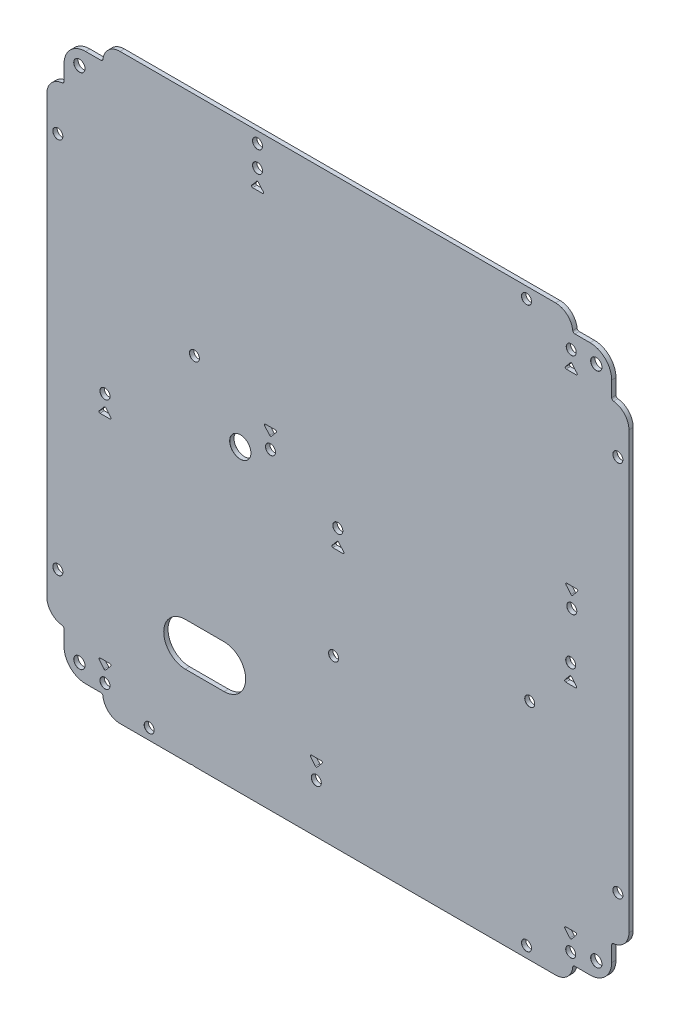
from build123d import *

# Parameters (mm, degrees)
SKETCH1_W                                = 270
SKETCH1_H                                = 270
BOSS_EXTRUDE1_DEPTH                      = 1
F_5_2_5_2_DIAMETER_HOLE1_AT_2_COUNT      = 2
F_5_2_5_2_DIAMETER_HOLE1_AT_2_PITCH      = 239.75
F_5_2_5_2_DIAMETER_HOLE1_AT_3_COUNT      = 2
F_5_2_5_2_DIAMETER_HOLE1_AT_3_PITCH      = 339.057701579
F_5_2_5_2_DIAMETER_HOLE1_AT_4_COUNT      = 2
F_5_2_5_2_DIAMETER_HOLE1_AT_4_PITCH      = 239.75
CUT_EXTRUDE1_DEPTH                       = 191.921449816
MIRROR1_AT_THE_SECOND_PLANE_COPY_1_DEPTH = 191.921449816
F_4_6_4_6_DIAMETER_HOLE1_AT_2_COUNT      = 2
F_4_6_4_6_DIAMETER_HOLE1_AT_2_PITCH      = 175
F_4_6_4_6_DIAMETER_HOLE1_AT_3_COUNT      = 2
F_4_6_4_6_DIAMETER_HOLE1_AT_3_PITCH      = 313.201313056
F_4_6_4_6_DIAMETER_HOLE1_AT_4_COUNT      = 2
F_4_6_4_6_DIAMETER_HOLE1_AT_4_PITCH      = 259.75
F_4_6_4_6_DIAMETER_HOLE1_AT_5_COUNT      = 2
F_4_6_4_6_DIAMETER_HOLE1_AT_5_PITCH      = 307.414673121
F_4_6_4_6_DIAMETER_HOLE1_AT_6_COUNT      = 2
F_4_6_4_6_DIAMETER_HOLE1_AT_6_PITCH      = 221.466772338
F_4_6_4_6_DIAMETER_HOLE1_AT_7_COUNT      = 2
F_4_6_4_6_DIAMETER_HOLE1_AT_7_PITCH      = 59.927299706
F_4_6_4_6_DIAMETER_HOLE1_AT_8_COUNT      = 2
F_4_6_4_6_DIAMETER_HOLE1_AT_8_PITCH      = 172.413474676
CUT_EXTRUDE2_DEPTH                       = 191.921449816
CUT_EXTRUDE2_DEPTH_BACK                  = 191.921449816
F_4_6_4_6_DIAMETER_HOLE2_AT_2_COUNT      = 2
F_4_6_4_6_DIAMETER_HOLE2_AT_2_PITCH      = 145.5
F_4_6_4_6_DIAMETER_HOLE2_AT_3_COUNT      = 2
F_4_6_4_6_DIAMETER_HOLE2_AT_3_PITCH      = 110.163514831
F_4_6_4_6_DIAMETER_HOLE2_AT_4_COUNT      = 2
F_4_6_4_6_DIAMETER_HOLE2_AT_4_PITCH      = 179.050446802
F_4_6_4_6_DIAMETER_HOLE2_AT_5_COUNT      = 2
F_4_6_4_6_DIAMETER_HOLE2_AT_5_PITCH      = 258.951625815
F_4_6_4_6_DIAMETER_HOLE3_AT_2_COUNT      = 2
F_4_6_4_6_DIAMETER_HOLE3_AT_2_PITCH      = 108
F_4_6_4_6_DIAMETER_HOLE3_AT_3_COUNT      = 2
F_4_6_4_6_DIAMETER_HOLE3_AT_3_PITCH      = 216
F_4_6_4_6_DIAMETER_HOLE3_AT_4_COUNT      = 2
F_4_6_4_6_DIAMETER_HOLE3_AT_4_PITCH      = 116.25
F_4_6_4_6_DIAMETER_HOLE3_AT_5_COUNT      = 2
F_4_6_4_6_DIAMETER_HOLE3_AT_5_PITCH      = 144.544327111
F_4_6_4_6_DIAMETER_HOLE3_AT_6_COUNT      = 2
F_4_6_4_6_DIAMETER_HOLE3_AT_6_PITCH      = 245.295867271
CUT_EXTRUDE3_DEPTH                       = 191.921449816
CUT_EXTRUDE4_DEPTH                       = 191.921449816
F_4_6_4_6_DIAMETER_HOLE4_AT_2_COUNT      = 2
F_4_6_4_6_DIAMETER_HOLE4_AT_2_PITCH      = 109.308336828
F_4_6_4_6_DIAMETER_HOLE4_AT_3_COUNT      = 2
F_4_6_4_6_DIAMETER_HOLE4_AT_3_PITCH      = 167.03667262


with BuildPart() as part:
    # Sketch1 → Boss-Extrude1 (new, symmetric)
    with BuildSketch(Plane.XY):
        Rectangle(SKETCH1_W, SKETCH1_H)
    extrude(amount=BOSS_EXTRUDE1_DEPTH, both=True)

    # Sketch11 → Ø5.2 (5.2) Diameter Hole1 (revolve, cut)
    with BuildSketch(Plane(origin=(119.875, 119.875, 1), x_dir=(0, -1, 0), z_dir=(1, 0, 0))):
        Polygon((0, 0), (0, 2), (2.625, 2), (2.6, 1.975), (2.6, 0.025), (2.625, 0), align=None)
    f_5_2_5_2_diameter_hole1 = revolve(axis=Axis((119.875, 119.875, 7.35), (0, 0, -1)), mode=Mode.SUBTRACT)

    # Ø5.2 (5.2) Diameter Hole1 at 2: Ø5.2 (5.2) Diameter Hole1 ×2
    with Locations(*[(0, -i * F_5_2_5_2_DIAMETER_HOLE1_AT_2_PITCH, 0) for i in range(1, F_5_2_5_2_DIAMETER_HOLE1_AT_2_COUNT)]):
        add(f_5_2_5_2_diameter_hole1, mode=Mode.SUBTRACT)

    # Ø5.2 (5.2) Diameter Hole1 at 3: Ø5.2 (5.2) Diameter Hole1 ×2
    with Locations(*[Vector(-0.7071067811865476, -0.7071067811865476, 0) * (i * F_5_2_5_2_DIAMETER_HOLE1_AT_3_PITCH) for i in range(1, F_5_2_5_2_DIAMETER_HOLE1_AT_3_COUNT)]):
        add(f_5_2_5_2_diameter_hole1, mode=Mode.SUBTRACT)

    # Ø5.2 (5.2) Diameter Hole1 at 4: Ø5.2 (5.2) Diameter Hole1 ×2
    with Locations(*[(-i * F_5_2_5_2_DIAMETER_HOLE1_AT_4_PITCH, 0, 0) for i in range(1, F_5_2_5_2_DIAMETER_HOLE1_AT_4_COUNT)]):
        add(f_5_2_5_2_diameter_hole1, mode=Mode.SUBTRACT)

    # Sketch12 → Cut-Extrude1 (cut, symmetric)
    with BuildSketch(Plane.XY):
        with BuildLine():
            Line((-127, 109.94427191), (-127, 117))
            ThreePointArc((-127, 117), (-124.071067812, 124.071067812), (-117, 127))
            Line((-117, 127), (-109.94427191, 127))
            ThreePointArc((-109.94427191, 127), (-109.277605243, 127.254644008), (-108.95046392, 127.888888889))
            ThreePointArc((-108.95046392, 127.888888889), (-106.333333333, 132.96284794), (-101, 135))
            Line((-101, 135), (-135, 135))
            Line((-135, 135), (-135, 101))
            ThreePointArc((-135, 101), (-132.96284794, 106.333333333), (-127.888888889, 108.95046392))
            ThreePointArc((-127.888888889, 108.95046392), (-127.254644008, 109.277605243), (-127, 109.94427191))
        make_face()
    cut_extrude1 = extrude(amount=CUT_EXTRUDE1_DEPTH, both=True, mode=Mode.SUBTRACT)

    # Mirror1: Cut-Extrude1 across plane
    add(cut_extrude1.mirror(Plane(origin=(0, 0, 0), x_dir=(0, 0, 1), z_dir=(1, 0, 0))), mode=Mode.SUBTRACT)

    # Mirror1 at the second plane: Cut-Extrude1 across plane
    add(cut_extrude1.mirror(Plane.ZX), mode=Mode.SUBTRACT)

    # Mirror1 at the second plane copy 1 sketc → Mirror1 at the second plane copy 1 (cut, symmetric)
    with BuildSketch(Plane(origin=(0, 0, 0), x_dir=(-1, 0, 0), z_dir=(0, 0, 1))):
        with BuildLine():
            Line((-127, 109.94427191), (-127, 117))
            ThreePointArc((-127, 117), (-124.071067812, 124.071067812), (-117, 127))
            Line((-117, 127), (-109.94427191, 127))
            ThreePointArc((-109.94427191, 127), (-109.277605243, 127.254644008), (-108.95046392, 127.888888889))
            ThreePointArc((-108.95046392, 127.888888889), (-106.333333333, 132.96284794), (-101, 135))
            Line((-101, 135), (-135, 135))
            Line((-135, 135), (-135, 101))
            ThreePointArc((-135, 101), (-132.96284794, 106.333333333), (-127.888888889, 108.95046392))
            ThreePointArc((-127.888888889, 108.95046392), (-127.254644008, 109.277605243), (-127, 109.94427191))
        make_face()
    extrude(amount=MIRROR1_AT_THE_SECOND_PLANE_COPY_1_DEPTH, both=True, mode=Mode.SUBTRACT)

    # Sketch15 → Ø4.6 (4.6) Diameter Hole1 (revolve, cut)
    with BuildSketch(Plane(origin=(129.875, 87.5, 1), x_dir=(0, -1, 0), z_dir=(1, 0, 0))):
        Polygon((0, 0), (0, 2), (2.325, 2), (2.3, 1.975), (2.3, 0.025), (2.325, 0), align=None)
    f_4_6_4_6_diameter_hole1 = revolve(axis=Axis((129.875, 87.5, 7.35), (0, 0, -1)), mode=Mode.SUBTRACT)

    # Ø4.6 (4.6) Diameter Hole1 at 2: Ø4.6 (4.6) Diameter Hole1 ×2
    with Locations(*[(0, -i * F_4_6_4_6_DIAMETER_HOLE1_AT_2_PITCH, 0) for i in range(1, F_4_6_4_6_DIAMETER_HOLE1_AT_2_COUNT)]):
        add(f_4_6_4_6_diameter_hole1, mode=Mode.SUBTRACT)

    # Ø4.6 (4.6) Diameter Hole1 at 3: Ø4.6 (4.6) Diameter Hole1 ×2
    with Locations(*[Vector(-0.8293387963975757, -0.5587460610955756, 0) * (i * F_4_6_4_6_DIAMETER_HOLE1_AT_3_PITCH) for i in range(1, F_4_6_4_6_DIAMETER_HOLE1_AT_3_COUNT)]):
        add(f_4_6_4_6_diameter_hole1, mode=Mode.SUBTRACT)

    # Ø4.6 (4.6) Diameter Hole1 at 4: Ø4.6 (4.6) Diameter Hole1 ×2
    with Locations(*[(-i * F_4_6_4_6_DIAMETER_HOLE1_AT_4_PITCH, 0, 0) for i in range(1, F_4_6_4_6_DIAMETER_HOLE1_AT_4_COUNT)]):
        add(f_4_6_4_6_diameter_hole1, mode=Mode.SUBTRACT)

    # Ø4.6 (4.6) Diameter Hole1 at 5: Ø4.6 (4.6) Diameter Hole1 ×2
    with Locations(*[Vector(-0.7071067811865477, -0.7071067811865475, 0) * (i * F_4_6_4_6_DIAMETER_HOLE1_AT_5_PITCH) for i in range(1, F_4_6_4_6_DIAMETER_HOLE1_AT_5_COUNT)]):
        add(f_4_6_4_6_diameter_hole1, mode=Mode.SUBTRACT)

    # Ø4.6 (4.6) Diameter Hole1 at 6: Ø4.6 (4.6) Diameter Hole1 ×2
    with Locations(*[Vector(-0.19133795807186105, -0.9815242155957696, 0) * (i * F_4_6_4_6_DIAMETER_HOLE1_AT_6_PITCH) for i in range(1, F_4_6_4_6_DIAMETER_HOLE1_AT_6_COUNT)]):
        add(f_4_6_4_6_diameter_hole1, mode=Mode.SUBTRACT)

    # Ø4.6 (4.6) Diameter Hole1 at 7: Ø4.6 (4.6) Diameter Hole1 ×2
    with Locations(*[Vector(-0.7071067811865481, 0.7071067811865469, 0) * (i * F_4_6_4_6_DIAMETER_HOLE1_AT_7_PITCH) for i in range(1, F_4_6_4_6_DIAMETER_HOLE1_AT_7_COUNT)]):
        add(f_4_6_4_6_diameter_hole1, mode=Mode.SUBTRACT)

    # Ø4.6 (4.6) Diameter Hole1 at 8: Ø4.6 (4.6) Diameter Hole1 ×2
    with Locations(*[Vector(-0.9693267902270689, 0.2457754539169606, 0) * (i * F_4_6_4_6_DIAMETER_HOLE1_AT_8_PITCH) for i in range(1, F_4_6_4_6_DIAMETER_HOLE1_AT_8_COUNT)]):
        add(f_4_6_4_6_diameter_hole1, mode=Mode.SUBTRACT)

    # Sketch17 → Cut-Extrude2 (cut, two sides: drawn at the far end of the back side and taken through both)
    with BuildSketch(Plane.XY.offset(-CUT_EXTRUDE2_DEPTH_BACK)):
        with BuildLine():
            Line((-70.75, -78), (-52.75, -78))
            ThreePointArc((-52.75, -78), (-42.75, -88), (-52.75, -98))
            Line((-52.75, -98), (-70.75, -98))
            ThreePointArc((-70.75, -98), (-80.75, -88), (-70.75, -78))
        make_face()
    extrude(amount=CUT_EXTRUDE2_DEPTH + CUT_EXTRUDE2_DEPTH_BACK, mode=Mode.SUBTRACT)

    # Sketch19 → Ø9.8 (9.8) Diameter Hole1 (revolve, cut)
    with BuildSketch(Plane(origin=(-45.25, 4, 1), x_dir=(0, -1, 0), z_dir=(1, 0, 0))):
        Polygon((0, 0), (0, 2), (4.925, 2), (4.9, 1.975), (4.9, 0.025), (4.925, 0), align=None)
    revolve(axis=Axis((-45.25, 4, 7.35), (0, 0, -1)), mode=Mode.SUBTRACT)

    # Sketch23 → Ø4.6 (4.6) Diameter Hole2 (revolve, cut)
    with BuildSketch(Plane(origin=(-37.25, 120, 1), x_dir=(0, -1, 0), z_dir=(1, 0, 0))):
        Polygon((0, 0), (0, 2), (2.325, 2), (2.3, 1.975), (2.3, 0.025), (2.325, 0), align=None)
    f_4_6_4_6_diameter_hole2 = revolve(axis=Axis((-37.25, 120, 7.35), (0, 0, -1)), mode=Mode.SUBTRACT)

    # Ø4.6 (4.6) Diameter Hole2 at 2: Ø4.6 (4.6) Diameter Hole2 ×2
    with Locations(*[Vector(0.9999996309679177, -0.0008591065292096222, 0) * (i * F_4_6_4_6_DIAMETER_HOLE2_AT_2_PITCH) for i in range(1, F_4_6_4_6_DIAMETER_HOLE2_AT_2_COUNT)]):
        add(f_4_6_4_6_diameter_hole2, mode=Mode.SUBTRACT)

    # Ø4.6 (4.6) Diameter Hole2 at 3: Ø4.6 (4.6) Diameter Hole2 ×2
    with Locations(*[Vector(0.054464493159869856, -0.9985157079309461, 0) * (i * F_4_6_4_6_DIAMETER_HOLE2_AT_3_PITCH) for i in range(1, F_4_6_4_6_DIAMETER_HOLE2_AT_3_COUNT)]):
        add(f_4_6_4_6_diameter_hole2, mode=Mode.SUBTRACT)

    # Ø4.6 (4.6) Diameter Hole2 at 4: Ø4.6 (4.6) Diameter Hole2 ×2
    with Locations(*[Vector(0.8140163993065361, -0.5808418904142694, 0) * (i * F_4_6_4_6_DIAMETER_HOLE2_AT_4_PITCH) for i in range(1, F_4_6_4_6_DIAMETER_HOLE2_AT_4_COUNT)]):
        add(f_4_6_4_6_diameter_hole2, mode=Mode.SUBTRACT)

    # Ø4.6 (4.6) Diameter Hole2 at 5: Ø4.6 (4.6) Diameter Hole2 ×2
    with Locations(*[Vector(-0.11666908977326872, -0.9931708430534382, 0) * (i * F_4_6_4_6_DIAMETER_HOLE2_AT_5_PITCH) for i in range(1, F_4_6_4_6_DIAMETER_HOLE2_AT_5_COUNT)]):
        add(f_4_6_4_6_diameter_hole2, mode=Mode.SUBTRACT)

    # Sketch26 → Ø4.6 (4.6) Diameter Hole3 (revolve, cut)
    with BuildSketch(Plane(origin=(-108, -6, 1), x_dir=(0, -1, 0), z_dir=(1, 0, 0))):
        Polygon((0, 0), (0, 2), (2.325, 2), (2.3, 1.975), (2.3, 0.025), (2.325, 0), align=None)
    f_4_6_4_6_diameter_hole3 = revolve(axis=Axis((-108, -6, 7.35), (0, 0, -1)), mode=Mode.SUBTRACT)

    # Ø4.6 (4.6) Diameter Hole3 at 2: Ø4.6 (4.6) Diameter Hole3 ×2
    with Locations(*[(i * F_4_6_4_6_DIAMETER_HOLE3_AT_2_PITCH, 0, 0) for i in range(1, F_4_6_4_6_DIAMETER_HOLE3_AT_2_COUNT)]):
        add(f_4_6_4_6_diameter_hole3, mode=Mode.SUBTRACT)

    # Ø4.6 (4.6) Diameter Hole3 at 3: Ø4.6 (4.6) Diameter Hole3 ×2
    with Locations(*[(i * F_4_6_4_6_DIAMETER_HOLE3_AT_3_PITCH, 0, 0) for i in range(1, F_4_6_4_6_DIAMETER_HOLE3_AT_3_COUNT)]):
        add(f_4_6_4_6_diameter_hole3, mode=Mode.SUBTRACT)

    # Ø4.6 (4.6) Diameter Hole3 at 4: Ø4.6 (4.6) Diameter Hole3 ×2
    with Locations(*[(0, -i * F_4_6_4_6_DIAMETER_HOLE3_AT_4_PITCH, 0) for i in range(1, F_4_6_4_6_DIAMETER_HOLE3_AT_4_COUNT)]):
        add(f_4_6_4_6_diameter_hole3, mode=Mode.SUBTRACT)

    # Ø4.6 (4.6) Diameter Hole3 at 5: Ø4.6 (4.6) Diameter Hole3 ×2
    with Locations(*[Vector(0.6779927096320881, -0.7350686265143813, 0) * (i * F_4_6_4_6_DIAMETER_HOLE3_AT_5_PITCH) for i in range(1, F_4_6_4_6_DIAMETER_HOLE3_AT_5_COUNT)]):
        add(f_4_6_4_6_diameter_hole3, mode=Mode.SUBTRACT)

    # Ø4.6 (4.6) Diameter Hole3 at 6: Ø4.6 (4.6) Diameter Hole3 ×2
    with Locations(*[Vector(0.8805692586813223, -0.47391748297085057, 0) * (i * F_4_6_4_6_DIAMETER_HOLE3_AT_6_PITCH) for i in range(1, F_4_6_4_6_DIAMETER_HOLE3_AT_6_COUNT)]):
        add(f_4_6_4_6_diameter_hole3, mode=Mode.SUBTRACT)

    # Sketch27 → Cut-Extrude3 (cut, symmetric)
    with BuildSketch(Plane.XY):
        with BuildLine():
            Line((-39.548924331, 111), (-34.951075669, 111))
            ThreePointArc((-34.951075669, 111), (-34.497634529, 111.289307967), (-34.568929927, 111.82243547))
            Line((-34.568929927, 111.82243547), (-36.867854258, 114.547086528))
            ThreePointArc((-36.867854258, 114.547086528), (-37.25, 114.724651059), (-37.632145742, 114.547086528))
            Line((-37.632145742, 114.547086528), (-39.931070073, 111.82243547))
            ThreePointArc((-39.931070073, 111.82243547), (-40.002365471, 111.289307967), (-39.548924331, 111))
        make_face()
    cut_extrude3 = extrude(amount=CUT_EXTRUDE3_DEPTH, both=True, mode=Mode.SUBTRACT)

    # Sketch-Pattern1: Cut-Extrude3 at 4 more places
    with Locations((145.499946, -0.125, 0), (145.25, -126, 0), (37.25, -126, 0), (-70.75, -126, 0)):
        add(cut_extrude3, mode=Mode.SUBTRACT)

    # Sketch29 → Cut-Extrude4 (cut, symmetric)
    with BuildSketch(Plane.XY):
        with BuildLine():
            Line((-33.548924331, 19), (-28.951075669, 19))
            ThreePointArc((-28.951075669, 19), (-28.497634529, 18.710692033), (-28.568929927, 18.17756453))
            Line((-28.568929927, 18.17756453), (-30.867854258, 15.452913472))
            ThreePointArc((-30.867854258, 15.452913472), (-31.25, 15.275348941), (-31.632145742, 15.452913472))
            Line((-31.632145742, 15.452913472), (-33.931070073, 18.17756453))
            ThreePointArc((-33.931070073, 18.17756453), (-34.002365471, 18.710692033), (-33.548924331, 19))
        make_face()
    cut_extrude4 = extrude(amount=CUT_EXTRUDE4_DEPTH, both=True, mode=Mode.SUBTRACT)

    # Sketch-Pattern2: Cut-Extrude4 at 4 more places
    with Locations((139.75, 6, 0), (139.25, -132.25, 0), (21.25, -122.25, 0), (-76.75, -132.25, 0)):
        add(cut_extrude4, mode=Mode.SUBTRACT)

    # Sketch32 → Ø4.6 (4.6) Diameter Hole4 (revolve, cut)
    with BuildSketch(Plane(origin=(-66.5, 30, 1), x_dir=(0, -1, 0), z_dir=(1, 0, 0))):
        Polygon((0, 0), (0, 2), (2.325, 2), (2.3, 1.975), (2.3, 0.025), (2.325, 0), align=None)
    f_4_6_4_6_diameter_hole4 = revolve(axis=Axis((-66.5, 30, 7.35), (0, 0, -1)), mode=Mode.SUBTRACT)

    # Ø4.6 (4.6) Diameter Hole4 at 2: Ø4.6 (4.6) Diameter Hole4 ×2
    with Locations(*[Vector(0.590073930973555, -0.80734921563436, 0) * (i * F_4_6_4_6_DIAMETER_HOLE4_AT_2_PITCH) for i in range(1, F_4_6_4_6_DIAMETER_HOLE4_AT_2_COUNT)]):
        add(f_4_6_4_6_diameter_hole4, mode=Mode.SUBTRACT)

    # Ø4.6 (4.6) Diameter Hole4 at 3: Ø4.6 (4.6) Diameter Hole4 ×2
    with Locations(*[Vector(0.9309332948318848, -0.36518926678292596, 0) * (i * F_4_6_4_6_DIAMETER_HOLE4_AT_3_PITCH) for i in range(1, F_4_6_4_6_DIAMETER_HOLE4_AT_3_COUNT)]):
        add(f_4_6_4_6_diameter_hole4, mode=Mode.SUBTRACT)


solid = part.part
